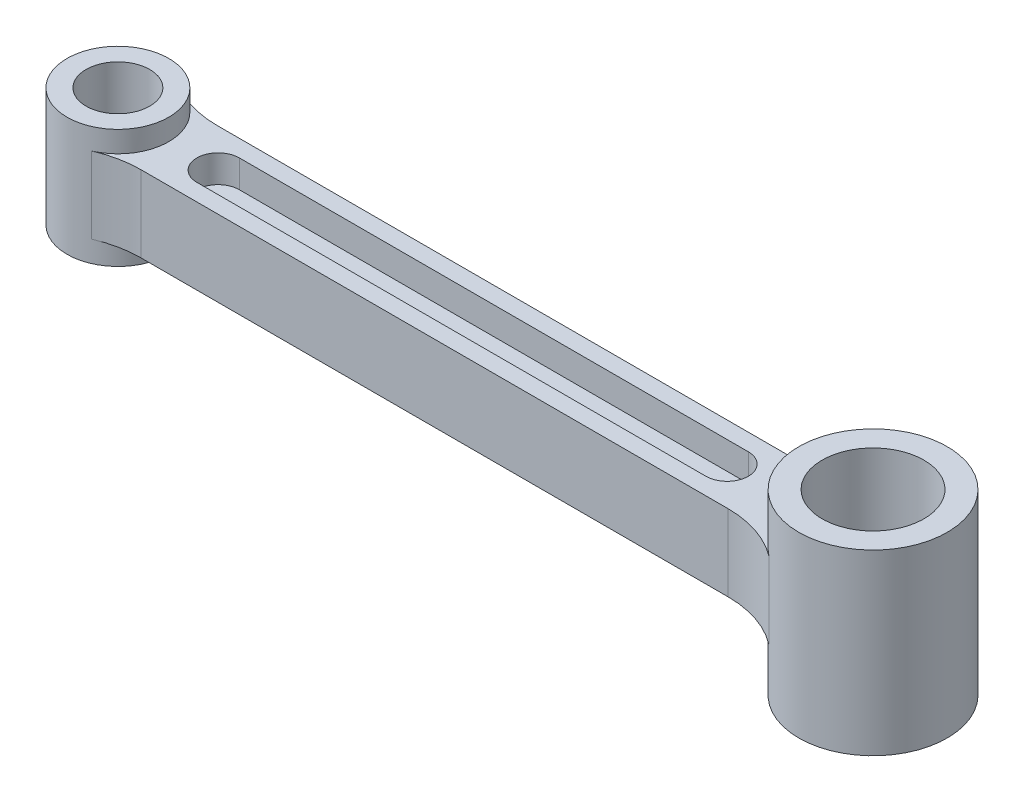
from build123d import *

# Parameters (mm, degrees)
SKETCH1_R           = 17.5
SKETCH1_R_2         = 12
BOSS_EXTRUDE1_DEPTH = 21
SKETCH1_5_R         = 12
SKETCH1_5_R_2       = 7.5
BOSS_EXTRUDE2_DEPTH = 14
BOSS_EXTRUDE3_DEPTH = 9
FILLET2_R           = 24
CUT_EXTRUDE1_START  = -2.5
SKETCH4_W           = 130
SKETCH4_H           = 10
CUT_EXTRUDE1_DEPTH  = 18
FILLET4_R           = 5
FILLET5_R           = 5
FILLET6_R           = 5
FILLET7_R           = 5


with BuildPart() as part:
    # Sketch1 → Boss-Extrude1 (new, symmetric)
    with BuildSketch(Plane(origin=(0, 0, 0), x_dir=(1, 0, 0), z_dir=(0, 1, 0))):
        with Locations(Location((178, 0, 0), (0, 0, 90))):
            Circle(SKETCH1_R)
        with Locations(Location((178, 0, 0), (0, 0, 90))):
            Circle(SKETCH1_R_2, mode=Mode.SUBTRACT)
    extrude(amount=BOSS_EXTRUDE1_DEPTH, both=True)



with BuildPart() as body_2:
    # Sketch1<5> → Boss-Extrude2 (new, symmetric)
    with BuildSketch(Plane(origin=(0, 0, 0), x_dir=(1, 0, 0), z_dir=(0, 1, 0))):
        with Locations(Location((0, 0, 0), (0, 0, 270))):
            Circle(SKETCH1_5_R)
        with Locations(Location((0, 0, 0), (0, 0, 270))):
            Circle(SKETCH1_5_R_2, mode=Mode.SUBTRACT)
    extrude(amount=BOSS_EXTRUDE2_DEPTH, both=True)


with BuildPart() as part_1:
    add(part.part)

    add(body_2.part)  # Boss-Extrude3 merges body 2
    # Sketch2 → Boss-Extrude3 (add, symmetric)
    with BuildSketch(Plane(origin=(0, 0, 0), x_dir=(1, 0, 0), z_dir=(0, 1, 0))):
        with BuildLine():
            Line((7.937253933, 9), (162.99166898, 9))
            ThreePointArc((162.99166898, 9), (160.5, 0), (162.99166898, -9))
            Line((162.99166898, -9), (7.937253933, -9))
            ThreePointArc((7.937253933, -9), (12, 0), (7.937253933, 9))
        make_face()
    extrude(amount=BOSS_EXTRUDE3_DEPTH, both=True)

    # Fillet2
    fillet2_edges = [part_1.edges().sort_by_distance(p)[0] for p in [
        (162.99166898, 0, 9),
        (162.99166898, 0, -9),
        (7.937253933, 0, -9),
        (7.937253933, 0, 9),
    ]]
    fillet(fillet2_edges, radius=FILLET2_R)

    # Sketch4 → Cut-Extrude1 (cut)
    with BuildSketch(Plane(origin=(0, 0, 0), x_dir=(1, 0, 0), z_dir=(0, 1, 0)).offset(CUT_EXTRUDE1_START)):
        with Locations((83.611517753, 0)):
            Rectangle(SKETCH4_W, SKETCH4_H)
    cut_extrude1 = extrude(amount=-CUT_EXTRUDE1_DEPTH, mode=Mode.SUBTRACT)

    # Mirror1: Cut-Extrude1 across plane
    add(cut_extrude1.mirror(Plane.ZX), mode=Mode.SUBTRACT)

    # Fillet4
    fillet4_edges = [part_1.edges().sort_by_distance(p)[0] for p in [
        (18.611517753, 5.75, -5),
        (18.611517753, 5.75, 5),
    ]]
    fillet(fillet4_edges, radius=FILLET4_R - 0.0001)  # a hair under: the kernel refuses the full size

    # Fillet5
    fillet5_edges = [part_1.edges().sort_by_distance(p)[0] for p in [
        (148.611517753, 5.75, 5),
        (148.611517753, 5.75, -5),
    ]]
    fillet(fillet5_edges, radius=FILLET5_R - 0.0001)  # a hair under: the kernel refuses the full size

    # Fillet6
    fillet6_edges = [part_1.edges().sort_by_distance(p)[0] for p in [
        (18.611517753, -5.75, 5),
        (18.611517753, -5.75, -5),
    ]]
    fillet(fillet6_edges, radius=FILLET6_R - 0.0001)  # a hair under: the kernel refuses the full size

    # Fillet7
    fillet7_edges = [part_1.edges().sort_by_distance(p)[0] for p in [
        (148.611517753, -5.75, -5),
        (148.611517753, -5.75, 5),
    ]]
    fillet(fillet7_edges, radius=FILLET7_R - 0.0001)  # a hair under: the kernel refuses the full size


solid = part_1.part
